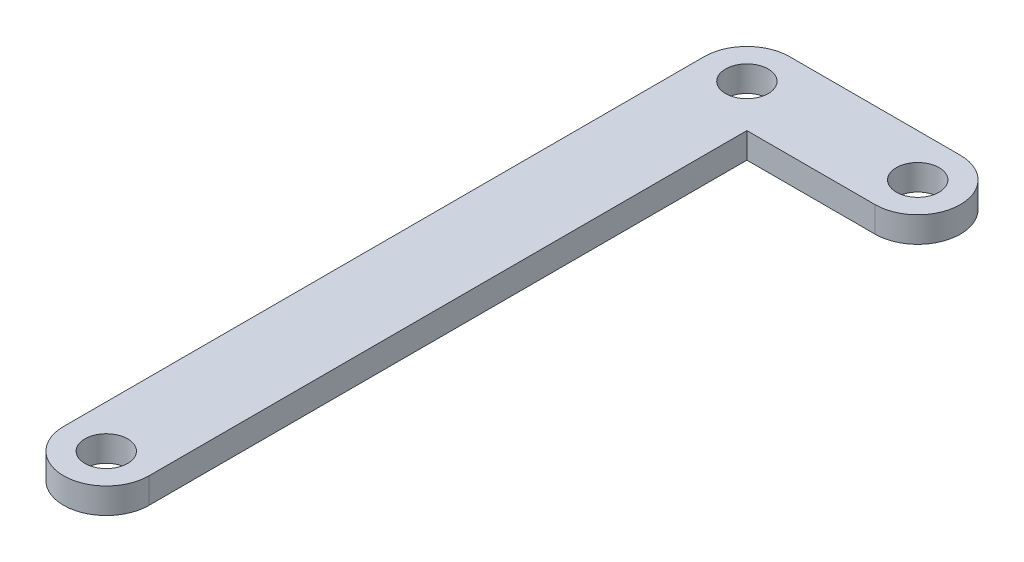
from build123d import *

# Parameters (mm, degrees)
SKETCH1_R           = 2.5
BOSS_EXTRUDE1_DEPTH = 3


with BuildPart() as part:
    # Sketch1 → Boss-Extrude1 (new body)
    with BuildSketch(Plane(origin=(0, 0, 0), x_dir=(1, 0, 0), z_dir=(0, 1, 0))):
        with BuildLine():
            Line((19.068769591, 26.574235382), (19.068769591, -48.425764618))
            ThreePointArc((19.068769591, -48.425764618), (24.068769591, -53.425764618), (29.068769591, -48.425764618))
            Line((29.068769591, -48.425764618), (29.068769591, 21.574235382))
            Line((29.068769591, 21.574235382), (44.068769591, 21.574235382))
            ThreePointArc((44.068769591, 21.574235382), (49.068769591, 26.574235382), (44.068769591, 31.574235382))
            Line((44.068769591, 31.574235382), (24.068769591, 31.574235382))
            ThreePointArc((24.068769591, 31.574235382), (20.533235685, 30.109769288), (19.068769591, 26.574235382))
        make_face()
        with Locations((24.068769591, 26.574235382)):
            Circle(SKETCH1_R, mode=Mode.SUBTRACT)
        with Locations((24.068769591, -48.425764618)):
            Circle(SKETCH1_R, mode=Mode.SUBTRACT)
        with Locations((44.068769591, 26.574235382)):
            Circle(SKETCH1_R, mode=Mode.SUBTRACT)
    extrude(amount=BOSS_EXTRUDE1_DEPTH)


solid = part.part
